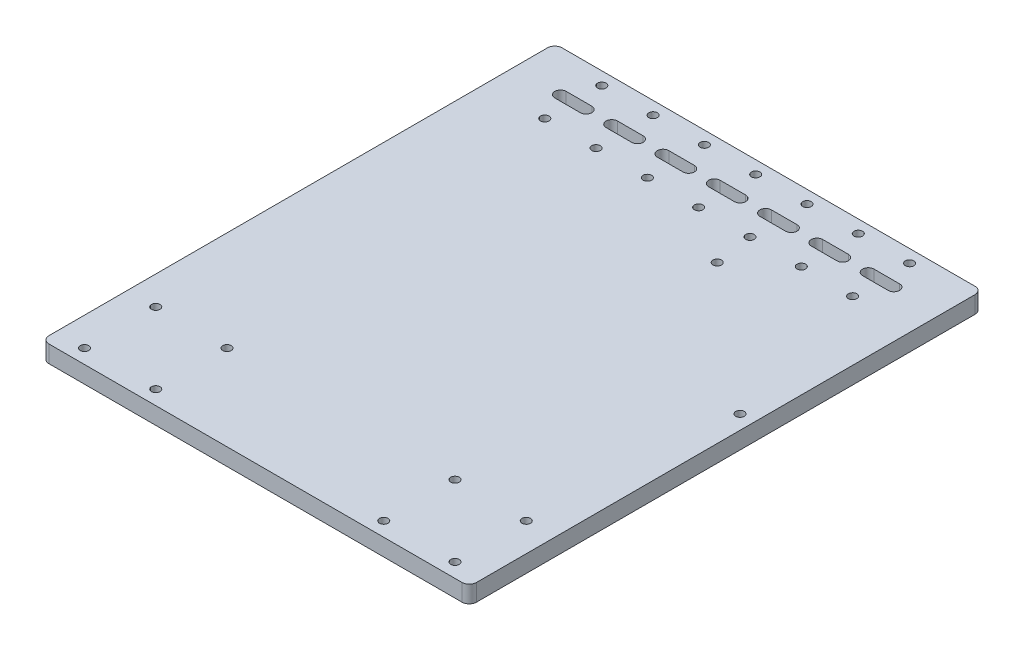
from build123d import *

# Parameters (mm, degrees)
SKETCH1_R           = 1.5
BOSS_EXTRUDE1_DEPTH = 6


with BuildPart() as part:
    # Sketch1 → Boss-Extrude1 (new body)
    with BuildSketch(Plane(origin=(0, 0, 0), x_dir=(1, 0, 0), z_dir=(0, 1, 0))):
        with BuildLine():
            Line((2.54, 0), (147.46, 0))
            ThreePointArc((147.46, 0), (149.256051224, 0.743948776), (150, 2.54))
            Line((150, 2.54), (150, 177.46))
            ThreePointArc((150, 177.46), (149.256051224, 179.256051224), (147.46, 180))
            Line((147.46, 180), (2.54, 180))
            ThreePointArc((2.54, 180), (0.743948776, 179.256051224), (0, 177.46))
            Line((0, 177.46), (0, 2.54))
            ThreePointArc((0, 2.54), (0.743948776, 0.743948776), (2.54, 0))
        make_face()
        with Locations((10, 30)):
            Circle(SKETCH1_R, mode=Mode.SUBTRACT)
        with Locations((35, 30)):
            Circle(SKETCH1_R, mode=Mode.SUBTRACT)
        with Locations((35, 5)):
            Circle(SKETCH1_R, mode=Mode.SUBTRACT)
        with Locations((10, 5)):
            Circle(SKETCH1_R, mode=Mode.SUBTRACT)
        with Locations((140, 5)):
            Circle(SKETCH1_R, mode=Mode.SUBTRACT)
        with Locations((115, 5)):
            Circle(SKETCH1_R, mode=Mode.SUBTRACT)
        with Locations((115, 30)):
            Circle(SKETCH1_R, mode=Mode.SUBTRACT)
        with Locations((140, 30)):
            Circle(SKETCH1_R, mode=Mode.SUBTRACT)
        with Locations((75, 155.5)):
            Circle(SKETCH1_R, mode=Mode.SUBTRACT)
        with Locations((39, 155.5)):
            Circle(SKETCH1_R, mode=Mode.SUBTRACT)
        with Locations((21, 155.5)):
            Circle(SKETCH1_R, mode=Mode.SUBTRACT)
        with Locations((57, 155.5)):
            Circle(SKETCH1_R, mode=Mode.SUBTRACT)
        with Locations((93, 155.5)):
            Circle(SKETCH1_R, mode=Mode.SUBTRACT)
        with Locations((111, 155.5)):
            Circle(SKETCH1_R, mode=Mode.SUBTRACT)
        with Locations((129, 155.5)):
            Circle(SKETCH1_R, mode=Mode.SUBTRACT)
        with Locations((129, 175.5)):
            Circle(SKETCH1_R, mode=Mode.SUBTRACT)
        with Locations((111, 175.5)):
            Circle(SKETCH1_R, mode=Mode.SUBTRACT)
        with Locations((93, 175.5)):
            Circle(SKETCH1_R, mode=Mode.SUBTRACT)
        with Locations((75, 175.5)):
            Circle(SKETCH1_R, mode=Mode.SUBTRACT)
        with Locations((57, 175.5)):
            Circle(SKETCH1_R, mode=Mode.SUBTRACT)
        with Locations((39, 175.5)):
            Circle(SKETCH1_R, mode=Mode.SUBTRACT)
        with Locations((21, 175.5)):
            Circle(SKETCH1_R, mode=Mode.SUBTRACT)
        with Locations((145, 100)):
            Circle(SKETCH1_R, mode=Mode.SUBTRACT)
        with Locations((95, 142)):
            Circle(SKETCH1_R, mode=Mode.SUBTRACT)
        with BuildLine():
            Line((133.5, 167.5), (124.5, 167.5))
            ThreePointArc((124.5, 167.5), (122.5, 165.5), (124.5, 163.5))
            Line((124.5, 163.5), (133.5, 163.5))
            ThreePointArc((133.5, 163.5), (135.5, 165.5), (133.5, 167.5))
        make_face(mode=Mode.SUBTRACT)
        with BuildLine():
            Line((16.5, 167.5), (25.5, 167.5))
            ThreePointArc((25.5, 167.5), (27.5, 165.5), (25.5, 163.5))
            Line((25.5, 163.5), (16.5, 163.5))
            ThreePointArc((16.5, 163.5), (14.5, 165.5), (16.5, 167.5))
        make_face(mode=Mode.SUBTRACT)
        with BuildLine():
            Line((34.5, 167.5), (43.5, 167.5))
            ThreePointArc((43.5, 167.5), (45.5, 165.5), (43.5, 163.5))
            Line((43.5, 163.5), (34.5, 163.5))
            ThreePointArc((34.5, 163.5), (32.5, 165.5), (34.5, 167.5))
        make_face(mode=Mode.SUBTRACT)
        with BuildLine():
            Line((52.5, 167.5), (61.5, 167.5))
            ThreePointArc((61.5, 167.5), (63.5, 165.5), (61.5, 163.5))
            Line((61.5, 163.5), (52.5, 163.5))
            ThreePointArc((52.5, 163.5), (50.5, 165.5), (52.5, 167.5))
        make_face(mode=Mode.SUBTRACT)
        with BuildLine():
            Line((70.5, 167.5), (79.5, 167.5))
            ThreePointArc((79.5, 167.5), (81.5, 165.5), (79.5, 163.5))
            Line((79.5, 163.5), (70.5, 163.5))
            ThreePointArc((70.5, 163.5), (68.5, 165.5), (70.5, 167.5))
        make_face(mode=Mode.SUBTRACT)
        with BuildLine():
            Line((115.5, 167.5), (106.5, 167.5))
            ThreePointArc((106.5, 167.5), (104.5, 165.5), (106.5, 163.5))
            Line((106.5, 163.5), (115.5, 163.5))
            ThreePointArc((115.5, 163.5), (117.5, 165.5), (115.5, 167.5))
        make_face(mode=Mode.SUBTRACT)
        with BuildLine():
            Line((97.5, 167.5), (88.5, 167.5))
            ThreePointArc((88.5, 167.5), (86.5, 165.5), (88.5, 163.5))
            Line((88.5, 163.5), (97.5, 163.5))
            ThreePointArc((97.5, 163.5), (99.5, 165.5), (97.5, 167.5))
        make_face(mode=Mode.SUBTRACT)
    extrude(amount=BOSS_EXTRUDE1_DEPTH)


solid = part.part
